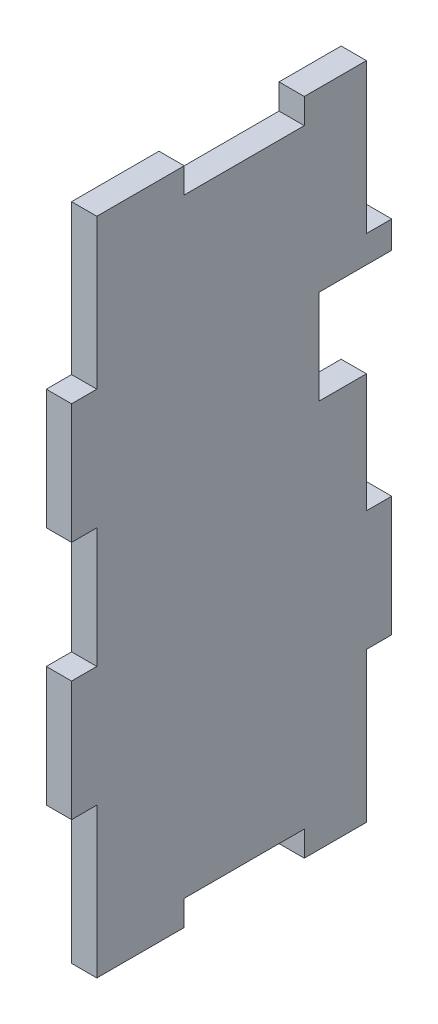
from build123d import *

# Parameters (mm, degrees)
BOSS_EXTRUDE1_DEPTH = 3
SKETCH2_W           = 10
SKETCH2_H           = 11.192112216
CUT_EXTRUDE1_DEPTH  = 10


with BuildPart() as part:
    # Sketch1 → Boss-Extrude1 (new body)
    with BuildSketch(Plane(origin=(0, 0, 0), x_dir=(0, 0, -1), z_dir=(1, 0, 0))):
        Polygon((-18.557859796, 36.983092069), (-18.557859796, 19.208092069), (-21.557859796, 19.208092069), (-21.557859796, 4.958092069), (-18.557859796, 4.958092069), (-18.557859796, -9.291907931), (-21.557859796, -9.291907931), (-21.557859796, -23.541907931), (-18.557859796, -23.541907931), (-18.557859796, -37.791907931), (-18.557859796, -41.316907931), (-8.182859796, -41.316907931), (-8.182859796, -38.316907931), (6.067140204, -38.316907931), (6.067140204, -41.316907931), (13.442140204, -41.316907931), (13.442140204, -23.541907931), (16.442140204, -23.541907931), (16.442140204, -9.291907931), (13.442140204, -9.291907931), (13.442140204, 4.958092069), (16.442140204, 4.958092069), (16.442140204, 19.208092069), (13.442140204, 19.208092069), (13.442140204, 33.458092069), (13.442140204, 36.983092069), (6.067140204, 36.983092069), (6.067140204, 33.983092069), (-8.182859796, 33.983092069), (-8.182859796, 36.983092069), align=None)
    extrude(amount=BOSS_EXTRUDE1_DEPTH)

    # Sketch2 → Cut-Extrude1 (cut)
    with BuildSketch(Plane(origin=(3, 0, 0), x_dir=(0, 0, -1), z_dir=(1, 0, 0))):
        with Locations((12.814396731, 10.387035961)):
            Rectangle(SKETCH2_W, SKETCH2_H)
    extrude(amount=-CUT_EXTRUDE1_DEPTH, mode=Mode.SUBTRACT)


solid = part.part
